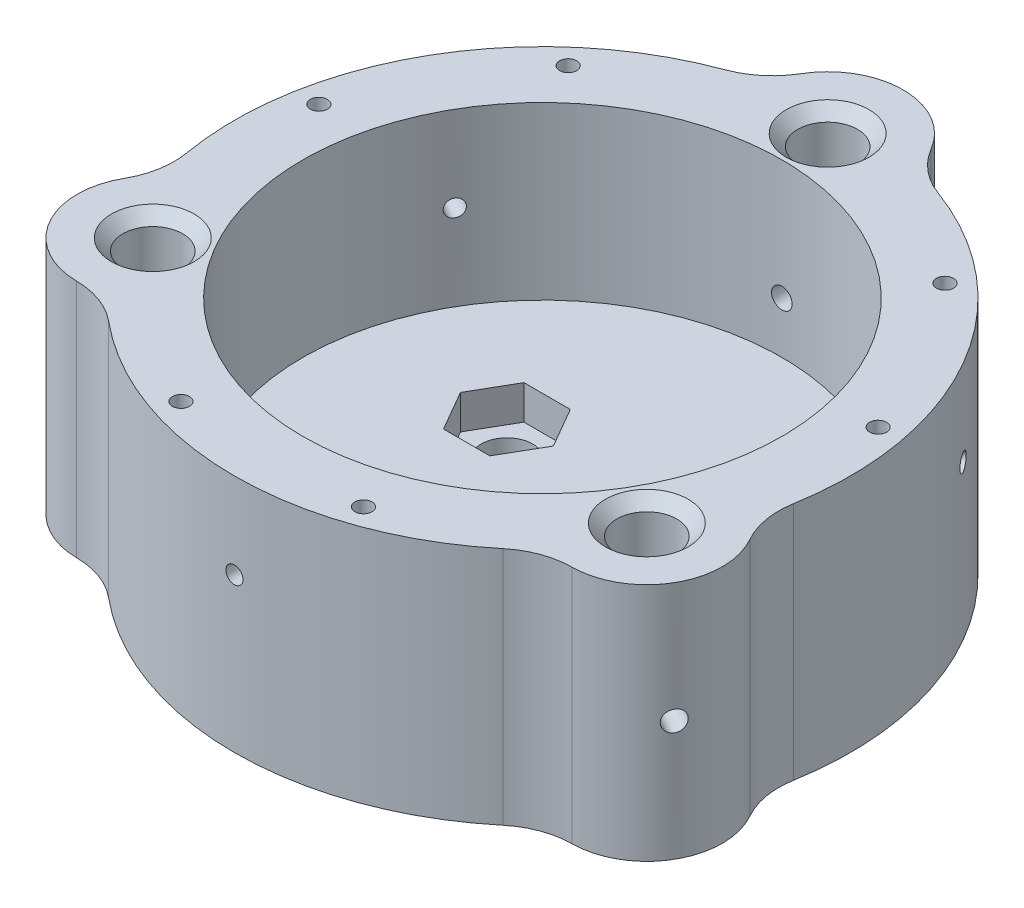
from build123d import *

# Parameters (mm, degrees)
SKETCH_1_R               = 2.625
SKETCH_1_R_2             = 21
EXTRUDE_1_DEPTH          = 15
EXTRUDE_START            = 6
EXTRUDE_2_DEPTH          = 6
FILLET_1_R               = 7
CHAMFER_1_SIZE           = 1
SKETCH_4_R               = 2.25
CUT_EXTRUDE_1_DEPTH      = 48.335527685
CUT_EXTRUDE_2_DEPTH      = 3
SKETCH_6_R               = 0.75
CUT_EXTRUDE_3_DEPTH      = 48.335527685
SKETCH_7_R               = 0.75
CUT_EXTRUDE_4_DEPTH      = 45.996135167
PATTERN_CIRCULAR_1_COUNT = 3
CUT_EXTRUDE_5_REACH      = 68.794
CUT_EXTRUDE_5_END_RADIUS = 21
SKETCH_8_R               = 0.9
PATTERN_CIRCULAR_2_COUNT = 3


with BuildPart() as part:
    # Эскиз1 → Бобышка-Вытянуть1 (new body)
    with BuildSketch(Plane(origin=(0, 0, 0), x_dir=(1, 0, 0), z_dir=(0, 1, 0))):
        with BuildLine():
            ThreePointArc((6.515011145, 26.2021875), (0, 31.625), (-6.515011145, 26.2021875))
            ThreePointArc((-6.515011145, 26.2021875), (-23.382685902, 13.5), (-25.949265582, -7.458928593))
            ThreePointArc((-25.949265582, -7.458928593), (-27.388053395, -15.8125), (-19.434254437, -18.743258907))
            ThreePointArc((-19.434254437, -18.743258907), (0, -27), (19.434254437, -18.743258907))
            ThreePointArc((19.434254437, -18.743258907), (27.388053395, -15.8125), (25.949265582, -7.458928593))
            ThreePointArc((25.949265582, -7.458928593), (23.382685902, 13.5), (6.515011145, 26.2021875))
        make_face()
        with Locations((0, 25)):
            Circle(SKETCH_1_R, mode=Mode.SUBTRACT)
        Circle(SKETCH_1_R_2, mode=Mode.SUBTRACT)
        with Locations((21.650635095, -12.5)):
            Circle(SKETCH_1_R, mode=Mode.SUBTRACT)
        with Locations((-21.650635095, -12.5)):
            Circle(SKETCH_1_R, mode=Mode.SUBTRACT)
    extrude(amount=EXTRUDE_1_DEPTH)

    # Эскиз2 → Бобышка-Вытянуть2 (add)
    with BuildSketch(Plane.XZ.offset(EXTRUDE_START)):
        with BuildLine():
            ThreePointArc((25.949265582, 7.458928593), (27.388053395, 15.8125), (19.434254437, 18.743258907))
            ThreePointArc((19.434254437, 18.743258907), (0, 27), (-19.434254437, 18.743258907))
            ThreePointArc((-19.434254437, 18.743258907), (-27.388053395, 15.8125), (-25.949265582, 7.458928593))
            ThreePointArc((-25.949265582, 7.458928593), (-23.382685902, -13.5), (-6.515011145, -26.2021875))
            ThreePointArc((-6.515011145, -26.2021875), (0, -31.625), (6.515011145, -26.2021875))
            ThreePointArc((6.515011145, -26.2021875), (23.382685902, -13.5), (25.949265582, 7.458928593))
        make_face()
    extrude(amount=-EXTRUDE_2_DEPTH)

    # Скругление1
    fillet_1_edges = [part.edges().sort_by_distance(p)[0] for p in [
        (6.515011145, 4.5, -26.2021875),
        (-6.515011145, 4.5, -26.2021875),
        (-25.949265582, 4.5, 7.458928593),
        (-19.434254437, 4.5, 18.743258907),
        (19.434254437, 4.5, 18.743258907),
        (25.949265582, 4.5, 7.458928593),
    ]]
    fillet(fillet_1_edges, radius=FILLET_1_R)

    # Фаска1
    chamfer_1_edges = [part.edges().sort_by_distance(p)[0] for p in [
        (-2.625, 15, -25),
        (19.025635095, 15, 12.5),
        (-24.275635095, 15, 12.5),
    ]]
    chamfer(chamfer_1_edges, length=CHAMFER_1_SIZE)

    # Эскиз4 → Вырез-Вытянуть1 (cut, through all)
    with BuildSketch(Plane.XZ.offset(6)):
        with Locations((0, 8.5)):
            Circle(SKETCH_4_R)
        with Locations((7.361215932, -4.25)):
            Circle(SKETCH_4_R)
        with Locations((-7.361215932, -4.25)):
            Circle(SKETCH_4_R)
    extrude(amount=-CUT_EXTRUDE_1_DEPTH, mode=Mode.SUBTRACT)

    # Эскиз5 → Вырез-Вытянуть2 (cut)
    with BuildSketch(Plane(origin=(0, 0, 0), x_dir=(1, 0, 0), z_dir=(0, 1, 0))):
        Polygon((2.035159699, -12.025), (4.070319398, -8.5), (2.035159699, -4.975), (-2.035159699, -4.975), (-4.070319398, -8.5), (-2.035159699, -12.025), align=None)
        Polygon((5.326056233, 0.725), (9.396375631, 0.725), (11.43153533, 4.25), (9.396375631, 7.775), (5.326056233, 7.775), (3.290896534, 4.25), align=None)
        Polygon((-11.43153533, 4.25), (-9.396375631, 0.725), (-5.326056233, 0.725), (-3.290896534, 4.25), (-5.326056233, 7.775), (-9.396375631, 7.775), align=None)
    extrude(amount=-CUT_EXTRUDE_2_DEPTH, mode=Mode.SUBTRACT)

    # Эскиз6 → Вырез-Вытянуть3 (cut, through all)
    with BuildSketch(Plane(origin=(0, 15, 0), x_dir=(1, 0, 0), z_dir=(0, 1, 0))):
        with Locations((-8, -23.685438565)):
            Circle(SKETCH_6_R)
        with Locations((8, -23.685438565)):
            Circle(SKETCH_6_R)
        with Locations((-16.512191497, 18.770922513)):
            Circle(SKETCH_6_R)
        with Locations((-24.512191497, 4.914516052)):
            Circle(SKETCH_6_R)
        with Locations((24.512191497, 4.914516052)):
            Circle(SKETCH_6_R)
        with Locations((16.512191497, 18.770922513)):
            Circle(SKETCH_6_R)
    extrude(amount=-CUT_EXTRUDE_3_DEPTH, mode=Mode.SUBTRACT)

    # Эскиз7 → Вырез-Вытянуть4 (cut, through all)
    with BuildSketch(Plane.XY):
        with Locations((0, 7.5)):
            Circle(SKETCH_7_R)
    cut_extrude_4 = extrude(amount=CUT_EXTRUDE_4_DEPTH, mode=Mode.SUBTRACT)

    # Круговой массив1: Вырез-Вытянуть4 ×3 about axis
    pattern_circular_1_axis = Axis((0, 15, 0), (0, -1, 0))
    for i in range(1, PATTERN_CIRCULAR_1_COUNT):
        add(cut_extrude_4.rotate(pattern_circular_1_axis, i * 360 / PATTERN_CIRCULAR_1_COUNT), mode=Mode.SUBTRACT)

    # Вырез-Вытянуть5: up to this cylinder (the profile starts outside it)
    cut_extrude_5_end = Plane(origin=(0, 4.5, 0), z_dir=(0, -1, 0)) * Cylinder(CUT_EXTRUDE_5_END_RADIUS, 180.588, mode=Mode.PRIVATE)
    # Эскиз8 → Вырез-Вытянуть5 (cut, up to the surface)
    with BuildSketch(Plane(origin=(0, 0, -31.625), x_dir=(-1, 0, 0), z_dir=(0, 0, -1)), mode=Mode.PRIVATE) as cut_extrude_5_sk1:
        with Locations((0, 4.5)):
            Circle(SKETCH_8_R)
    cut_extrude_5_tool1 = extrude(cut_extrude_5_sk1.sketch, amount=-CUT_EXTRUDE_5_REACH, mode=Mode.PRIVATE) - cut_extrude_5_end
    cut_extrude_5 = cut_extrude_5_tool1.solids().sort_by_distance((0, 4.5, -31.625))[0]
    add(cut_extrude_5, mode=Mode.SUBTRACT)

    # Круговой массив2: Вырез-Вытянуть5 ×3 about axis
    pattern_circular_2_axis = Axis((0, 15, 0), (0, -1, 0))
    for i in range(1, PATTERN_CIRCULAR_2_COUNT):
        add(cut_extrude_5.rotate(pattern_circular_2_axis, i * 360 / PATTERN_CIRCULAR_2_COUNT), mode=Mode.SUBTRACT)


solid = part.part
